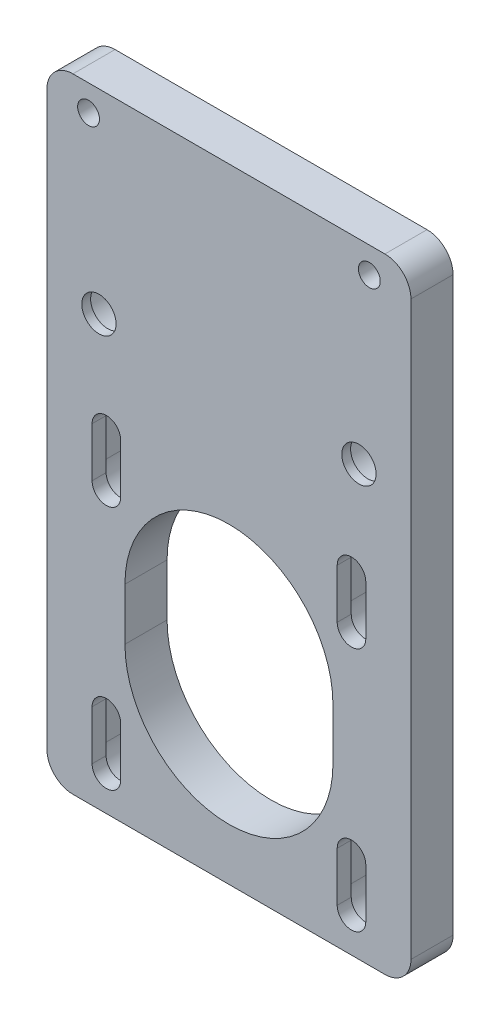
from build123d import *

# Parameters (mm, degrees)
BOSS_EXTRU_1_DEPTH                                 = 8
BOSS_EXTRU_1_DEPTH_BACK                            = 0.1
ESQUISSE1_W                                        = 70
ESQUISSE1_H                                        = 120
CHAMBRAGE_POUR_VIS_T_TE_HEXAGONALE_M62_D           = 6.6
CHAMBRAGE_POUR_VIS_T_TE_HEXAGONALE_M62_CBORE_D     = 11
CHAMBRAGE_POUR_VIS_T_TE_HEXAGONALE_M62_CBORE_DEPTH = 6.4
ESQUISSE4_R                                        = 20
ENL_V_MAT_EXTRU_1_DEPTH                            = 70.932896408
RAINURE_START                                      = -0.1
RAINURE_DE_CHAMBRAGE_POUR_VIS_T_TE_HEX_DEPTH       = 5.4
RAINURE_START_2                                    = 5.3
RAINURE_DE_CHAMBRAGE_POUR_VIS_T_TE_3_DEPTH         = 3.7
TROU_POUR_TARAUDAGE_POUR_TROU_TARAUD_M5_D          = 4.2
CONG_1_R                                           = 5


with BuildPart() as part:
    # Esquisse1 → Boss.-Extru.1 (new, two sides: drawn at the far end of the back side and taken through both)
    with BuildSketch(Plane.XY.offset(-BOSS_EXTRU_1_DEPTH_BACK)):
        Rectangle(ESQUISSE1_W, ESQUISSE1_H)
    extrude(amount=BOSS_EXTRU_1_DEPTH + BOSS_EXTRU_1_DEPTH_BACK)

    # Chambrage pour vis à tête hexagonale M62 (through all)
    with Locations(Plane(origin=(0, 0, -0.1), x_dir=(-1, 0, 0), z_dir=(0, 0, -1))):
        with Locations((25, 22.5), (-25, 22.5)):
            CounterBoreHole(CHAMBRAGE_POUR_VIS_T_TE_HEXAGONALE_M62_D / 2, CHAMBRAGE_POUR_VIS_T_TE_HEXAGONALE_M62_CBORE_D / 2, CHAMBRAGE_POUR_VIS_T_TE_HEXAGONALE_M62_CBORE_DEPTH)

    # Esquisse4 → Enlèv. mat.-Extru.1 (cut, through all)
    with BuildSketch(Plane.XY.offset(8)):
        with Locations((0, -20)):
            Circle(ESQUISSE4_R)
        with BuildLine():
            Line((20, -30), (20, -20))
            ThreePointArc((20, -20), (0, -40), (-20, -20))
            Line((-20, -20), (-20, -30))
            ThreePointArc((-20, -30), (0, -50), (20, -30))
        make_face()
    extrude(amount=-ENL_V_MAT_EXTRU_1_DEPTH, mode=Mode.SUBTRACT)

    # Rainure de chambrage pour vis à tête hexagonale M53: read off the stored shape, not the designer's step
    # Rainure de chambrage pour vis _ t_te 2 → Rainure de chambrage pour vis à tête hexagonale M53 (cut)
    with BuildSketch(Plane.XY.offset(RAINURE_START)):
        with BuildLine():
            ThreePointArc((-18.57, 3.57), (-23.57, 8.57), (-28.57, 3.57))
            Line((-28.57, 3.57), (-28.57, -5.93))
            ThreePointArc((-28.57, -5.93), (-23.57, -10.93), (-18.57, -5.93))
            Line((-18.57, -5.93), (-18.57, 3.57))
        make_face()
        with BuildLine():
            Line((-18.57, -53.07), (-18.57, -43.57))
            ThreePointArc((-18.57, -43.57), (-23.57, -38.57), (-28.57, -43.57))
            Line((-28.57, -43.57), (-28.57, -53.07))
            ThreePointArc((-28.57, -53.07), (-23.57, -58.07), (-18.57, -53.07))
        make_face()
        with BuildLine():
            ThreePointArc((28.57, -43.57), (23.57, -38.57), (18.57, -43.57))
            Line((18.57, -43.57), (18.57, -53.07))
            ThreePointArc((18.57, -53.07), (23.57, -58.07), (28.57, -53.07))
            Line((28.57, -53.07), (28.57, -43.57))
        make_face()
        with BuildLine():
            Line((28.57, -5.93), (28.57, 3.57))
            ThreePointArc((28.57, 3.57), (23.57, 8.57), (18.57, 3.57))
            Line((18.57, 3.57), (18.57, -5.93))
            ThreePointArc((18.57, -5.93), (23.57, -10.93), (28.57, -5.93))
        make_face()
    extrude(amount=RAINURE_DE_CHAMBRAGE_POUR_VIS_T_TE_HEX_DEPTH, mode=Mode.SUBTRACT)

    # Rainure de chambrage pour vis _ t_te 3 o → Rainure de chambrage pour vis _ t_te 3 (cut)
    with BuildSketch(Plane.XY.offset(RAINURE_START_2)):
        with BuildLine():
            ThreePointArc((-20.82, 3.57), (-23.57, 6.32), (-26.32, 3.57))
            Line((-26.32, 3.57), (-26.32, -5.93))
            ThreePointArc((-26.32, -5.93), (-23.57, -8.68), (-20.82, -5.93))
            Line((-20.82, -5.93), (-20.82, 3.57))
        make_face()
        with BuildLine():
            Line((-20.82, -53.07), (-20.82, -43.57))
            ThreePointArc((-20.82, -43.57), (-23.57, -40.82), (-26.32, -43.57))
            Line((-26.32, -43.57), (-26.32, -53.07))
            ThreePointArc((-26.32, -53.07), (-23.57, -55.82), (-20.82, -53.07))
        make_face()
        with BuildLine():
            ThreePointArc((26.32, -43.57), (23.57, -40.82), (20.82, -43.57))
            Line((20.82, -43.57), (20.82, -53.07))
            ThreePointArc((20.82, -53.07), (23.57, -55.82), (26.32, -53.07))
            Line((26.32, -53.07), (26.32, -43.57))
        make_face()
        with BuildLine():
            Line((26.32, -5.93), (26.32, 3.57))
            ThreePointArc((26.32, 3.57), (23.57, 6.32), (20.82, 3.57))
            Line((20.82, 3.57), (20.82, -5.93))
            ThreePointArc((20.82, -5.93), (23.57, -8.68), (26.32, -5.93))
        make_face()
    extrude(amount=RAINURE_DE_CHAMBRAGE_POUR_VIS_T_TE_3_DEPTH, mode=Mode.SUBTRACT)

    # Rainure de chambrage pour vis _ t_te 4: loft between two sections, ruled curve by curve
    rainure_de_chambrage_pour_vis_t_te_4_from = [
        Edge.make_three_point_arc((-28.57, 3.57, -0.075), (-27.105533906, 7.105533906, -0.075), (-23.57, 8.57, -0.075)),
        Edge.make_three_point_arc((-23.57, 8.57, -0.075), (-20.034466094, 7.105533906, -0.075), (-18.57, 3.57, -0.075)),
        Edge.make_three_point_arc((-18.57, -5.93, -0.075), (-20.034466094, -9.465533906, -0.075), (-23.57, -10.93, -0.075)),
        Edge.make_three_point_arc((-23.57, -10.93, -0.075), (-27.105533906, -9.465533906, -0.075), (-28.57, -5.93, -0.075)),
        Edge.make_line((-18.57, 3.57, -0.075), (-18.57, -5.93, -0.075)),
        Edge.make_line((-28.57, 3.57, -0.075), (-28.57, -5.93, -0.075)),
    ]
    rainure_de_chambrage_pour_vis_t_te_4_to = [
        Edge.make_three_point_arc((-28.595, 3.57, -0.1), (-27.123211575, 7.123211575, -0.1), (-23.57, 8.595, -0.1)),
        Edge.make_three_point_arc((-23.57, 8.595, -0.1), (-20.016788425, 7.123211575, -0.1), (-18.545, 3.57, -0.1)),
        Edge.make_three_point_arc((-18.545, -5.93, -0.1), (-20.016788425, -9.483211575, -0.1), (-23.57, -10.955, -0.1)),
        Edge.make_three_point_arc((-23.57, -10.955, -0.1), (-27.123211575, -9.483211575, -0.1), (-28.595, -5.93, -0.1)),
        Edge.make_line((-18.545, 3.57, -0.1), (-18.545, -5.93, -0.1)),
        Edge.make_line((-28.595, 3.57, -0.1), (-28.595, -5.93, -0.1)),
    ]
    rainure_de_chambrage_pour_vis_t_te_4 = Solid(Shell([*[Face.make_surface_from_curves(rainure_de_chambrage_pour_vis_t_te_4_from[k], rainure_de_chambrage_pour_vis_t_te_4_to[k]) for k in range(6)], Face(Wire(rainure_de_chambrage_pour_vis_t_te_4_from)), Face(Wire(rainure_de_chambrage_pour_vis_t_te_4_to))]))
    add(rainure_de_chambrage_pour_vis_t_te_4, mode=Mode.SUBTRACT)

    # Rainure de chambrage pour vis _ t_te 5: loft between two sections, ruled curve by curve
    rainure_de_chambrage_pour_vis_t_te_5_from = [
        Edge.make_three_point_arc((-28.57, -43.57, -0.075), (-27.105533906, -40.034466094, -0.075), (-23.57, -38.57, -0.075)),
        Edge.make_three_point_arc((-23.57, -38.57, -0.075), (-20.034466094, -40.034466094, -0.075), (-18.57, -43.57, -0.075)),
        Edge.make_three_point_arc((-18.57, -53.07, -0.075), (-20.034466094, -56.605533906, -0.075), (-23.57, -58.07, -0.075)),
        Edge.make_three_point_arc((-23.57, -58.07, -0.075), (-27.105533906, -56.605533906, -0.075), (-28.57, -53.07, -0.075)),
        Edge.make_line((-18.57, -43.57, -0.075), (-18.57, -53.07, -0.075)),
        Edge.make_line((-28.57, -43.57, -0.075), (-28.57, -53.07, -0.075)),
    ]
    rainure_de_chambrage_pour_vis_t_te_5_to = [
        Edge.make_three_point_arc((-28.595, -43.57, -0.1), (-27.123211575, -40.016788425, -0.1), (-23.57, -38.545, -0.1)),
        Edge.make_three_point_arc((-23.57, -38.545, -0.1), (-20.016788425, -40.016788425, -0.1), (-18.545, -43.57, -0.1)),
        Edge.make_three_point_arc((-18.545, -53.07, -0.1), (-20.016788425, -56.623211575, -0.1), (-23.57, -58.095, -0.1)),
        Edge.make_three_point_arc((-23.57, -58.095, -0.1), (-27.123211575, -56.623211575, -0.1), (-28.595, -53.07, -0.1)),
        Edge.make_line((-18.545, -43.57, -0.1), (-18.545, -53.07, -0.1)),
        Edge.make_line((-28.595, -43.57, -0.1), (-28.595, -53.07, -0.1)),
    ]
    rainure_de_chambrage_pour_vis_t_te_5 = Solid(Shell([*[Face.make_surface_from_curves(rainure_de_chambrage_pour_vis_t_te_5_from[k], rainure_de_chambrage_pour_vis_t_te_5_to[k]) for k in range(6)], Face(Wire(rainure_de_chambrage_pour_vis_t_te_5_from)), Face(Wire(rainure_de_chambrage_pour_vis_t_te_5_to))]))
    add(rainure_de_chambrage_pour_vis_t_te_5, mode=Mode.SUBTRACT)

    # Rainure de chambrage pour vis _ t_te 6: loft between two sections, ruled curve by curve
    rainure_de_chambrage_pour_vis_t_te_6_from = [
        Edge.make_three_point_arc((18.57, -43.57, -0.075), (20.034466094, -40.034466094, -0.075), (23.57, -38.57, -0.075)),
        Edge.make_three_point_arc((23.57, -38.57, -0.075), (27.105533906, -40.034466094, -0.075), (28.57, -43.57, -0.075)),
        Edge.make_three_point_arc((28.57, -53.07, -0.075), (27.105533906, -56.605533906, -0.075), (23.57, -58.07, -0.075)),
        Edge.make_three_point_arc((23.57, -58.07, -0.075), (20.034466094, -56.605533906, -0.075), (18.57, -53.07, -0.075)),
        Edge.make_line((28.57, -43.57, -0.075), (28.57, -53.07, -0.075)),
        Edge.make_line((18.57, -43.57, -0.075), (18.57, -53.07, -0.075)),
    ]
    rainure_de_chambrage_pour_vis_t_te_6_to = [
        Edge.make_three_point_arc((18.545, -43.57, -0.1), (20.016788425, -40.016788425, -0.1), (23.57, -38.545, -0.1)),
        Edge.make_three_point_arc((23.57, -38.545, -0.1), (27.123211575, -40.016788425, -0.1), (28.595, -43.57, -0.1)),
        Edge.make_three_point_arc((28.595, -53.07, -0.1), (27.123211575, -56.623211575, -0.1), (23.57, -58.095, -0.1)),
        Edge.make_three_point_arc((23.57, -58.095, -0.1), (20.016788425, -56.623211575, -0.1), (18.545, -53.07, -0.1)),
        Edge.make_line((28.595, -43.57, -0.1), (28.595, -53.07, -0.1)),
        Edge.make_line((18.545, -43.57, -0.1), (18.545, -53.07, -0.1)),
    ]
    rainure_de_chambrage_pour_vis_t_te_6 = Solid(Shell([*[Face.make_surface_from_curves(rainure_de_chambrage_pour_vis_t_te_6_from[k], rainure_de_chambrage_pour_vis_t_te_6_to[k]) for k in range(6)], Face(Wire(rainure_de_chambrage_pour_vis_t_te_6_from)), Face(Wire(rainure_de_chambrage_pour_vis_t_te_6_to))]))
    add(rainure_de_chambrage_pour_vis_t_te_6, mode=Mode.SUBTRACT)

    # Rainure de chambrage pour vis _ t_te 7: loft between two sections, ruled curve by curve
    rainure_de_chambrage_pour_vis_t_te_7_from = [
        Edge.make_three_point_arc((18.57, 3.57, -0.075), (20.034466094, 7.105533906, -0.075), (23.57, 8.57, -0.075)),
        Edge.make_three_point_arc((23.57, 8.57, -0.075), (27.105533906, 7.105533906, -0.075), (28.57, 3.57, -0.075)),
        Edge.make_three_point_arc((28.57, -5.93, -0.075), (27.105533906, -9.465533906, -0.075), (23.57, -10.93, -0.075)),
        Edge.make_three_point_arc((23.57, -10.93, -0.075), (20.034466094, -9.465533906, -0.075), (18.57, -5.93, -0.075)),
        Edge.make_line((28.57, 3.57, -0.075), (28.57, -5.93, -0.075)),
        Edge.make_line((18.57, 3.57, -0.075), (18.57, -5.93, -0.075)),
    ]
    rainure_de_chambrage_pour_vis_t_te_7_to = [
        Edge.make_three_point_arc((18.545, 3.57, -0.1), (20.016788425, 7.123211575, -0.1), (23.57, 8.595, -0.1)),
        Edge.make_three_point_arc((23.57, 8.595, -0.1), (27.123211575, 7.123211575, -0.1), (28.595, 3.57, -0.1)),
        Edge.make_three_point_arc((28.595, -5.93, -0.1), (27.123211575, -9.483211575, -0.1), (23.57, -10.955, -0.1)),
        Edge.make_three_point_arc((23.57, -10.955, -0.1), (20.016788425, -9.483211575, -0.1), (18.545, -5.93, -0.1)),
        Edge.make_line((28.595, 3.57, -0.1), (28.595, -5.93, -0.1)),
        Edge.make_line((18.545, 3.57, -0.1), (18.545, -5.93, -0.1)),
    ]
    rainure_de_chambrage_pour_vis_t_te_7 = Solid(Shell([*[Face.make_surface_from_curves(rainure_de_chambrage_pour_vis_t_te_7_from[k], rainure_de_chambrage_pour_vis_t_te_7_to[k]) for k in range(6)], Face(Wire(rainure_de_chambrage_pour_vis_t_te_7_from)), Face(Wire(rainure_de_chambrage_pour_vis_t_te_7_to))]))
    add(rainure_de_chambrage_pour_vis_t_te_7, mode=Mode.SUBTRACT)

    # Trou pour taraudage pour trou taraudé M51 (through all)
    with Locations(Plane(origin=(0, 0, -0.1), x_dir=(-1, 0, 0), z_dir=(0, 0, -1))):
        with Locations((-27, 55), (27, 55)):
            Hole(TROU_POUR_TARAUDAGE_POUR_TROU_TARAUD_M5_D / 2)

    # Congé1
    cong_1_edges = [part.edges().sort_by_distance(p)[0] for p in [
        (35, -60, 3.95),
        (-35, -60, 3.95),
        (-35, 60, 3.95),
        (35, 60, 3.95),
    ]]
    fillet(cong_1_edges, radius=CONG_1_R)


solid = part.part
